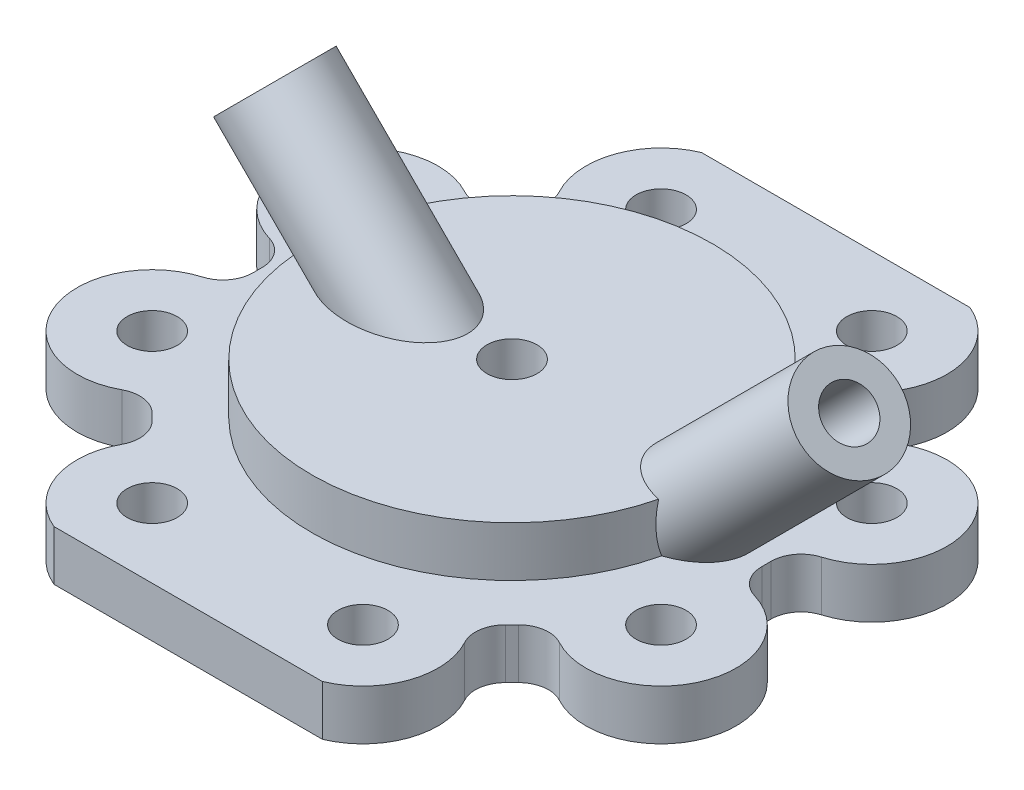
from build123d import *

# Parameters (mm, degrees)
BODY_SKETCH_R                       = 25.4
BODY_DEPTH                          = 12.7
FLANGE_SKETCH_R                     = 44.45
FLANGE_SKETCH_R_2                   = 25.4
FLANGE_DEPTH                        = 6.35
GOX_DOWNCOMER_SPOUT_PROFILE_R       = 6.35
GOX_DOWNCOMER_HOLE_PROFILE_R        = 3.175
RP1_DOWNCOMER_SPOUT_PROFILE_R       = 6.35
RP1_DOWNCOMER_HOLE_PROFILE_R        = 3.175
GOX_START                           = -5.898986164
GOX_ORIFICE_OUTLINE_R               = 0.76073
GOX_ORIFICE_DEPTH                   = 3.955803778
RP1_START                           = -12.02870816
RP1_ORIFICE_OUTLINE_R               = 0.76835
RP1_ORIFICE_DEPTH                   = 3.962093734
ORIFICE_PATTERN_COUNT               = 8
BOLT_HOLE_PROFILE_R                 = 3.175
BOLT_HOLE_DEPTH                     = 6.35
BOLT_PATTERN_COUNT                  = 8
IGNITOR_SKETCH_R                    = 3.175
IGNITOR_HOLE_DEPTH                  = 12.7
SCALLOP_DEPTH                       = 6.35
SCALLOP_FILLET_R                    = 3.81
SCALLOP_PATTERN_COUNT               = 8
SCALLOP_FILLET_OF_SCALLOP_PATTERN_R = 3.81
WORKMOUNT_DEPTH                     = 6.35


# Read off the part's stored shape, not the designer's step: gox orifice, rp1 orifice
with BuildPart() as part:
    # body sketch → body (new body)
    with BuildSketch(Plane(origin=(0, 0, 0), x_dir=(1, 0, 0), z_dir=(0, 1, 0))):
        with Locations(Location((0, 0, 0), (0, 0, 270))):
            Circle(BODY_SKETCH_R)
    extrude(amount=BODY_DEPTH)

    # flange sketch → flange (add)
    with BuildSketch(Plane(origin=(0, 0, 0), x_dir=(1, 0, 0), z_dir=(0, 1, 0))):
        with Locations(Location((0, 0, 0), (0, 0, 270))):
            Circle(FLANGE_SKETCH_R)
        with Locations(Location((0, 0, 0), (0, 0, 270))):
            Circle(FLANGE_SKETCH_R_2, mode=Mode.SUBTRACT)
    extrude(amount=FLANGE_DEPTH)

    # gox downcomer spout: sweep along a path in gox downcomer spout path
    with BuildLine(Plane.XY) as gox_downcomer_spout_path:
        Line((-7.62, 5.715), (-30.070640303, 28.165640303))
    # gox downcomer spout profile (on start of the path) → gox downcomer spout (sweep)
    with BuildSketch(Plane(origin=(-7.62, 5.715, 0), x_dir=(-0.7071067811865475, -0.7071067811865476, 0), z_dir=(-0.7071067811865476, 0.7071067811865475, 0))):
        Circle(GOX_DOWNCOMER_SPOUT_PROFILE_R)
    sweep(path=gox_downcomer_spout_path.line)

    # gox downcomer hole: sweep along a path in gox downcomer hole path
    with BuildLine(Plane.XY) as gox_downcomer_hole_path:
        Line((-7.62, 5.715), (-30.070640303, 28.165640303))
    # gox downcomer hole profile (on start of the path) → gox downcomer hole (sweep, cut)
    with BuildSketch(Plane(origin=(-7.62, 5.715, 0), x_dir=(-0.7071067811865475, -0.7071067811865476, 0), z_dir=(-0.7071067811865476, 0.7071067811865475, 0))):
        Circle(GOX_DOWNCOMER_HOLE_PROFILE_R)
    sweep(path=gox_downcomer_hole_path.line, mode=Mode.SUBTRACT)

    # rp1 downcomer spout: sweep along a path in rp1 downcomer spout path
    with BuildLine(Plane.XY) as rp1_downcomer_spout_path:
        Line((20.32, 5.715), (42.770640303, 28.165640303))
    # rp1 downcomer spout profile (on start of the path) → rp1 downcomer spout (sweep)
    with BuildSketch(Plane(origin=(20.32, 5.715, 0), x_dir=(-0.7071067811865474, 0.7071067811865477, 0), z_dir=(0.7071067811865477, 0.7071067811865474, 0))):
        Circle(RP1_DOWNCOMER_SPOUT_PROFILE_R)
    sweep(path=rp1_downcomer_spout_path.line)

    # rp1 downcomer hole: sweep along a path in rp1 downcomer hole path
    with BuildLine(Plane.XY) as rp1_downcomer_hole_path:
        Line((20.32, 5.715), (42.770640303, 28.165640303))
    # rp1 downcomer hole profile (on start of the path) → rp1 downcomer hole (sweep, cut)
    with BuildSketch(Plane(origin=(20.32, 5.715, 0), x_dir=(-0.7071067811865474, 0.7071067811865477, 0), z_dir=(0.7071067811865477, 0.7071067811865474, 0))):
        Circle(RP1_DOWNCOMER_HOLE_PROFILE_R)
    sweep(path=rp1_downcomer_hole_path.line, mode=Mode.SUBTRACT)

    # gox distributor: sweep along a path in gox ring path
    with BuildLine(Plane(origin=(0, 0, 0), x_dir=(1, 0, 0), z_dir=(0, 1, 0))) as gox_distributor_path:
        CenterArc((0, 0), 7.62, 0, 360)
    # gox ring profile → gox distributor (sweep, cut)
    with BuildSketch(Plane.XY):
        with BuildLine():
            Line((-9.86506403, 7.96006403), (-7.62, 10.205128061))
            Line((-7.62, 10.205128061), (-5.37493597, 7.96006403))
            ThreePointArc((-5.37493597, 7.96006403), (-7.62, 2.54), (-9.86506403, 7.96006403))
        make_face()
    sweep(path=gox_distributor_path.line, mode=Mode.SUBTRACT)

    # rp1 distributor: sweep along a path in rp1 ring path
    with BuildLine(Plane(origin=(0, 0, 0), x_dir=(1, 0, 0), z_dir=(0, 1, 0))) as rp1_distributor_path:
        CenterArc((0, 0), 20.32, 0, 360)
    # rp1 ring profile → rp1 distributor (sweep, cut)
    with BuildSketch(Plane.XY):
        with BuildLine():
            Line((-22.56506403, 7.96006403), (-20.32, 10.205128061))
            Line((-20.32, 10.205128061), (-18.07493597, 7.96006403))
            ThreePointArc((-18.07493597, 7.96006403), (-20.32, 2.54), (-22.56506403, 7.96006403))
        make_face()
    sweep(path=rp1_distributor_path.line, mode=Mode.SUBTRACT)

    # gox orifice outline → gox orifice (cut)
    with BuildSketch(Plane(origin=(0, 0, 0), x_dir=(0.866025403784438, -0.500000000000001, 0), z_dir=(0.500000000000001, 0.866025403784438, 0)).offset(GOX_START)):
        with Locations((-9.456613577, 0)):
            Circle(GOX_ORIFICE_OUTLINE_R)
    gox_orifice = extrude(amount=GOX_ORIFICE_DEPTH, mode=Mode.SUBTRACT)

    # rp1 orifice outline → rp1 orifice (cut)
    with BuildSketch(Plane(origin=(0, 0, 0), x_dir=(0.866025403784438, 0.500000000000001, 0), z_dir=(0.500000000000001, -0.866025403784438, 0)).offset(RP1_START)):
        with Locations((-14.740136205, 0)):
            Circle(RP1_ORIFICE_OUTLINE_R)
    rp1_orifice = extrude(amount=RP1_ORIFICE_DEPTH, mode=Mode.SUBTRACT)

    # orifice pattern: gox orifice, rp1 orifice ×8 about axis
    orifice_pattern_axis = Axis((0, 0, 0), (0, -1, 0))
    add([gox_orifice.rotate(orifice_pattern_axis, i * 360 / ORIFICE_PATTERN_COUNT) for i in range(1, ORIFICE_PATTERN_COUNT)], mode=Mode.SUBTRACT)
    add([rp1_orifice.rotate(orifice_pattern_axis, i * 360 / ORIFICE_PATTERN_COUNT) for i in range(1, ORIFICE_PATTERN_COUNT)], mode=Mode.SUBTRACT)

    # bolt hole profile → bolt hole (cut)
    with BuildSketch(Plane(origin=(0, 0, 0), x_dir=(0.9238795325112864, 0, 0.3826834323650906), z_dir=(0, 1, 0))):
        with Locations(Location((-34.925, 0, 0), (0, 0, 292.5))):
            Circle(BOLT_HOLE_PROFILE_R)
    bolt_hole = extrude(amount=BOLT_HOLE_DEPTH, mode=Mode.SUBTRACT)

    # bolt pattern: bolt hole ×8 about axis
    bolt_pattern_axis = Axis((0, 0, 0), (0, 1, 0))
    for i in range(1, BOLT_PATTERN_COUNT):
        add(bolt_hole.rotate(bolt_pattern_axis, i * 360 / BOLT_PATTERN_COUNT), mode=Mode.SUBTRACT)

    # ignitor sketch → ignitor hole (cut)
    with BuildSketch(Plane(origin=(0, 0, 0), x_dir=(1, 0, 0), z_dir=(0, 1, 0))):
        with Locations(Location((0, 0, 0), (0, 0, 90))):
            Circle(IGNITOR_SKETCH_R)
    extrude(amount=IGNITOR_HOLE_DEPTH, mode=Mode.SUBTRACT)

    # scallop profile → scallop (cut)
    with BuildSketch(Plane(origin=(0, 0, 0), x_dir=(1, 0, 0), z_dir=(0, 1, 0))):
        with BuildLine():
            Line((-32.266492673, 3.840218875), (-32.266492673, -3.840218875))
            ThreePointArc((-32.266492673, -3.840218875), (-40.18624073, -8.073412406), (-41.06644522, -17.010278569))
            ThreePointArc((-41.06644522, -17.010278569), (-44.45, 0), (-41.06644522, 17.010278569))
            ThreePointArc((-41.06644522, 17.010278569), (-40.18624073, 8.073412406), (-32.266492673, 3.840218875))
        make_face()
    scallop = extrude(amount=SCALLOP_DEPTH, mode=Mode.SUBTRACT)

    # scallop fillet
    scallop_fillet_edges = [part.edges().sort_by_distance(p)[0] for p in [
        (-32.266492673, 3.175, -3.840218875),
        (-32.266492673, 3.175, 3.840218875),
    ]]
    fillet(scallop_fillet_edges, radius=SCALLOP_FILLET_R)

    # scallop pattern: scallop ×8 about axis, 2 skipped
    scallop_pattern_axis = Axis((0, 0, 0), (0, 1, 0))
    add([scallop.rotate(scallop_pattern_axis, i * 360 / SCALLOP_PATTERN_COUNT) for i in range(1, SCALLOP_PATTERN_COUNT) if i not in (2, 6)], mode=Mode.SUBTRACT)

    # scallop fillet of scallop pattern
    scallop_fillet_of_scallop_pattern_edges = [part.edges().sort_by_distance(p)[0] for p in [
        (-25.531300582, 3.175, 20.100410966),
        (-20.100410966, 3.175, 25.531300582),
        (20.100410966, 3.175, 25.531300582),
        (25.531300582, 3.175, 20.100410966),
        (32.266492673, 3.175, 3.840218875),
        (32.266492673, 3.175, -3.840218875),
        (25.531300582, 3.175, -20.100410966),
        (20.100410966, 3.175, -25.531300582),
        (-20.100410966, 3.175, -25.531300582),
        (-25.531300582, 3.175, -20.100410966),
    ]]
    fillet(scallop_fillet_of_scallop_pattern_edges, radius=SCALLOP_FILLET_OF_SCALLOP_PATTERN_R)

    # Sketch223 → workmount (cut)
    with BuildSketch(Plane(origin=(0, 0, 0), x_dir=(1, 0, 0), z_dir=(0, 1, 0))):
        with BuildLine():
            Line((-17.010278569, -41.06644522), (17.010278569, -41.06644522))
            ThreePointArc((17.010278569, -41.06644522), (0, -44.45), (-17.010278569, -41.06644522))
        make_face()
        with BuildLine():
            Line((-17.010278569, 41.06644522), (17.010278569, 41.06644522))
            ThreePointArc((17.010278569, 41.06644522), (0, 44.45), (-17.010278569, 41.06644522))
        make_face()
    extrude(amount=WORKMOUNT_DEPTH, mode=Mode.SUBTRACT)


solid = part.part
